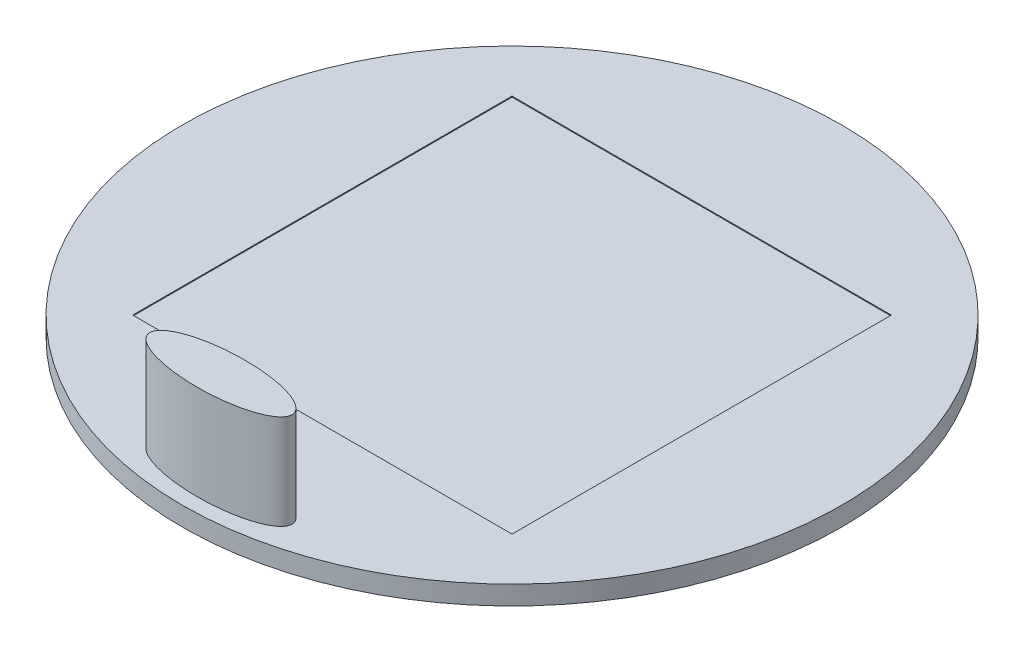
from build123d import *

# Parameters (mm, degrees)
SKETCH1_R           = 34.75
BOSS_EXTRUDE1_DEPTH = 2
CUT_EXTRUDE1_DEPTH  = 1
CUT_EXTRUDE2_DEPTH  = 1
SKETCH3_RX          = 7.5
SKETCH3_RY          = 2.5
BOSS_EXTRUDE2_DEPTH = 10
SKETCH4_W           = 40
SKETCH4_H           = 40
CUT_EXTRUDE3_DEPTH  = 0.1


with BuildPart() as part:
    # Sketch1 → Boss-Extrude1 (new body)
    with BuildSketch(Plane(origin=(0, 0, 0), x_dir=(1, 0, 0), z_dir=(0, 1, 0))):
        Circle(SKETCH1_R)
    extrude(amount=BOSS_EXTRUDE1_DEPTH)

    # Sketch1<4> → Cut-Extrude1 (cut)
    with BuildSketch(Plane(origin=(0, 0, 0), x_dir=(1, 0, 0), z_dir=(0, 1, 0))):
        Polygon((2.783800982, -2.2), (0, 5.59464275), (-2.783800982, -2.2), align=None)
    extrude(amount=CUT_EXTRUDE1_DEPTH, mode=Mode.SUBTRACT)

    # Sketch1<5> → Cut-Extrude2 (cut)
    with BuildSketch(Plane(origin=(0, 0, 0), x_dir=(1, 0, 0), z_dir=(0, 1, 0))):
        with BuildLine():
            Line((-33.107541348, -10.557140043), (-33.107541348, 10.557140043))
            ThreePointArc((-33.107541348, 10.557140043), (-34.75, 0), (-33.107541348, -10.557140043))
        make_face()
    extrude(amount=CUT_EXTRUDE2_DEPTH, mode=Mode.SUBTRACT)

    # Sketch3 → Boss-Extrude2 (add)
    with BuildSketch(Plane(origin=(0, 2, 0), x_dir=(1, 0, 0), z_dir=(0, 1, 0))):
        with Locations((0, -30.694699658)):
            Ellipse(SKETCH3_RX, SKETCH3_RY)
    extrude(amount=BOSS_EXTRUDE2_DEPTH)

    # Sketch4 → Cut-Extrude3 (cut)
    with BuildSketch(Plane(origin=(0, 2, 0), x_dir=(1, 0, 0), z_dir=(0, 1, 0))):
        Rectangle(SKETCH4_W, SKETCH4_H)
    extrude(amount=-CUT_EXTRUDE3_DEPTH, mode=Mode.SUBTRACT)


solid = part.part
